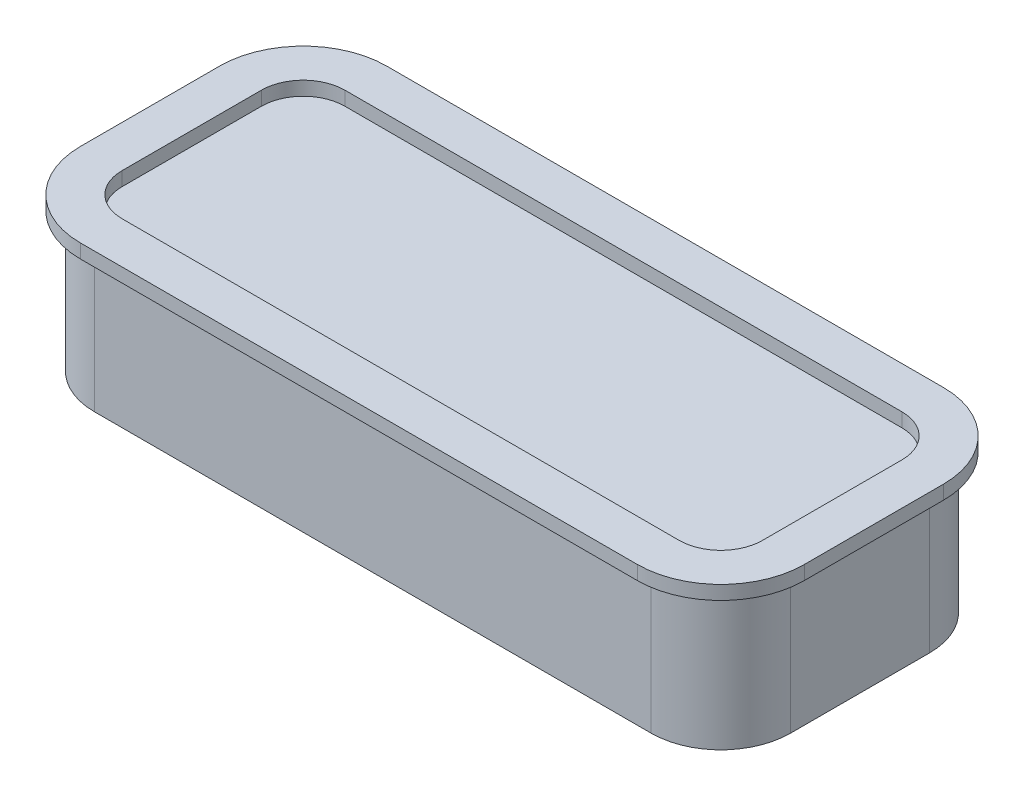
from build123d import *

# Parameters (mm, degrees)
SURFACE_EXTRUDE1_1_BACK  = 100
SURFACE_EXTRUDE1_1_DEPTH = 100
THICKEN1_T1              = 10
SURFACE_EXTRUDE2_2_DEPTH = 10
THICKEN2_T1              = 10
THICKEN2_T2              = 10
THICKEN3_START           = -100
THICKEN3_DEPTH           = 10
THICKEN4_DEPTH           = 10
THICKEN5_START           = -90
THICKEN5_DEPTH           = 90


# Read off the part's stored shape, not the designer's step: Thicken3, Thicken4, Thicken5
with BuildPart() as body_1:
    # Surface-Extrude1: a surface, the sketch's curves swept straight by 100 mm
    with BuildLine(Plane(origin=(0, 0, 0), x_dir=(1, 0, 0), z_dir=(0, 1, 0)).offset(-SURFACE_EXTRUDE1_1_BACK), mode=Mode.PRIVATE) as surface_extrude1_1_path:
        Line((-1.878720563, -34.460865773), (398.121279437, -34.460865773))
        ThreePointArc((398.121279437, -34.460865773), (433.476618497, -19.816204833), (448.121279437, 15.539134227))
        Line((448.121279437, 15.539134227), (448.121279437, 115.539134227))
        ThreePointArc((448.121279437, 115.539134227), (433.476618497, 150.894473286), (398.121279437, 165.539134227))
        Line((398.121279437, 165.539134227), (-1.878720563, 165.539134227))
        ThreePointArc((-1.878720563, 165.539134227), (-37.234059622, 150.894473286), (-51.878720563, 115.539134227))
        Line((-51.878720563, 115.539134227), (-51.878720563, 15.539134227))
        ThreePointArc((-51.878720563, 15.539134227), (-37.234059622, -19.816204833), (-1.878720563, -34.460865773))
    surface_extrude1_1 = Shell.extrude(surface_extrude1_1_path.wire(), (0 * SURFACE_EXTRUDE1_1_DEPTH, 1 * SURFACE_EXTRUDE1_1_DEPTH, 0 * SURFACE_EXTRUDE1_1_DEPTH))
    add(Solid.thicken(surface_extrude1_1, THICKEN1_T1))

    # Surface-Extrude2: a surface, the sketch's curves swept straight by 10 mm
    with BuildLine(Plane(origin=(0, 0, 0), x_dir=(1, 0, 0), z_dir=(0, 1, 0)), mode=Mode.PRIVATE) as surface_extrude2_2_path:
        Line((-1.878720563, -34.460865773), (398.121279437, -34.460865773))
        ThreePointArc((398.121279437, -34.460865773), (433.476618497, -19.816204833), (448.121279437, 15.539134227))
        Line((448.121279437, 15.539134227), (448.121279437, 115.539134227))
        ThreePointArc((448.121279437, 115.539134227), (433.476618497, 150.894473286), (398.121279437, 165.539134227))
        Line((398.121279437, 165.539134227), (-1.878720563, 165.539134227))
        ThreePointArc((-1.878720563, 165.539134227), (-37.234059622, 150.894473286), (-51.878720563, 115.539134227))
        Line((-51.878720563, 115.539134227), (-51.878720563, 15.539134227))
        ThreePointArc((-51.878720563, 15.539134227), (-37.234059622, -19.816204833), (-1.878720563, -34.460865773))
    surface_extrude2_2 = Shell.extrude(surface_extrude2_2_path.wire(), (0 * SURFACE_EXTRUDE2_2_DEPTH, 1 * SURFACE_EXTRUDE2_2_DEPTH, 0 * SURFACE_EXTRUDE2_2_DEPTH))
    add(Solid.thicken(surface_extrude2_2, THICKEN2_T1))
    add(Solid.thicken(surface_extrude2_2, -THICKEN2_T2))

    # Thicken3 outline → Thicken3 (add)
    with BuildSketch(Plane(origin=(0, 0, 0), x_dir=(1, 0, 0), z_dir=(0, 1, 0)).offset(THICKEN3_START)):
        with BuildLine():
            ThreePointArc((398.121279437, -24.460865773), (426.405550685, -12.745137021), (438.121279437, 15.539134227))
            Line((438.121279437, 15.539134227), (438.121279437, 115.539134227))
            ThreePointArc((438.121279437, 115.539134227), (426.405550684, 143.823405474), (398.121279437, 155.539134227))
            Line((398.121279437, 155.539134227), (-1.878720563, 155.539134227))
            ThreePointArc((-1.878720563, 155.539134227), (-30.16299181, 143.823405474), (-41.878720563, 115.539134227))
            Line((-41.878720563, 115.539134227), (-41.878720563, 15.539134227))
            ThreePointArc((-41.878720563, 15.539134227), (-30.16299181, -12.745137021), (-1.878720563, -24.460865773))
            Line((-1.878720563, -24.460865773), (398.121279437, -24.460865773))
        make_face()
        with BuildLine():
            ThreePointArc((398.121279437, 145.539134227), (419.334482873, 136.752337662), (428.121279437, 115.539134227))
            Line((428.121279437, 115.539134227), (428.121279437, 15.539134227))
            ThreePointArc((428.121279437, 15.539134227), (419.334482873, -5.674069209), (398.121279437, -14.460865773))
            Line((398.121279437, -14.460865773), (-1.878720563, -14.460865773))
            ThreePointArc((-1.878720563, -14.460865773), (-23.091923998, -5.674069208), (-31.878720563, 15.539134227))
            Line((-31.878720563, 15.539134227), (-31.878720563, 115.539134227))
            ThreePointArc((-31.878720563, 115.539134227), (-23.091923998, 136.752337662), (-1.878720563, 145.539134227))
            Line((-1.878720563, 145.539134227), (398.121279437, 145.539134227))
        make_face(mode=Mode.SUBTRACT)
    extrude(amount=THICKEN3_DEPTH)

    # Thicken4 outline → Thicken4 (add)
    with BuildSketch(Plane(origin=(0, 0, 0), x_dir=(1, 0, 0), z_dir=(0, 1, 0))):
        with BuildLine():
            ThreePointArc((398.121279437, -24.460865773), (426.405550685, -12.745137021), (438.121279437, 15.539134227))
            Line((438.121279437, 15.539134227), (438.121279437, 115.539134227))
            ThreePointArc((438.121279437, 115.539134227), (426.405550684, 143.823405474), (398.121279437, 155.539134227))
            Line((398.121279437, 155.539134227), (-1.878720563, 155.539134227))
            ThreePointArc((-1.878720563, 155.539134227), (-30.16299181, 143.823405474), (-41.878720563, 115.539134227))
            Line((-41.878720563, 115.539134227), (-41.878720563, 15.539134227))
            ThreePointArc((-41.878720563, 15.539134227), (-30.16299181, -12.745137021), (-1.878720563, -24.460865773))
            Line((-1.878720563, -24.460865773), (398.121279437, -24.460865773))
        make_face()
        with BuildLine():
            Line((-1.878720563, 145.539134227), (398.121279437, 145.539134227))
            ThreePointArc((398.121279437, 145.539134227), (419.334482873, 136.752337662), (428.121279437, 115.539134227))
            Line((428.121279437, 115.539134227), (428.121279437, 15.539134227))
            ThreePointArc((428.121279437, 15.539134227), (419.334482873, -5.674069209), (398.121279437, -14.460865773))
            Line((398.121279437, -14.460865773), (-1.878720563, -14.460865773))
            ThreePointArc((-1.878720563, -14.460865773), (-23.091923998, -5.674069208), (-31.878720563, 15.539134227))
            Line((-31.878720563, 15.539134227), (-31.878720563, 115.539134227))
            ThreePointArc((-31.878720563, 115.539134227), (-23.091923998, 136.752337662), (-1.878720563, 145.539134227))
        make_face(mode=Mode.SUBTRACT)
    extrude(amount=THICKEN4_DEPTH)


with BuildPart() as body_2:
    # Thicken5 outline → Thicken5 (new body)
    with BuildSketch(Plane(origin=(0, 0, 0), x_dir=(1, 0, 0), z_dir=(0, 1, 0)).offset(THICKEN5_START)):
        with BuildLine():
            ThreePointArc((-1.878720563, 155.539134227), (-30.16299181, 143.823405474), (-41.878720563, 115.539134227))
            Line((-41.878720563, 115.539134227), (-41.878720563, 15.539134227))
            ThreePointArc((-41.878720563, 15.539134227), (-30.16299181, -12.745137021), (-1.878720563, -24.460865773))
            Line((-1.878720563, -24.460865773), (398.121279437, -24.460865773))
            ThreePointArc((398.121279437, -24.460865773), (426.405550685, -12.745137021), (438.121279437, 15.539134227))
            Line((438.121279437, 15.539134227), (438.121279437, 115.539134227))
            ThreePointArc((438.121279437, 115.539134227), (426.405550684, 143.823405474), (398.121279437, 155.539134227))
            Line((398.121279437, 155.539134227), (-1.878720563, 155.539134227))
        make_face()
    extrude(amount=THICKEN5_DEPTH)


solid = Compound([body_1.part, body_2.part])
